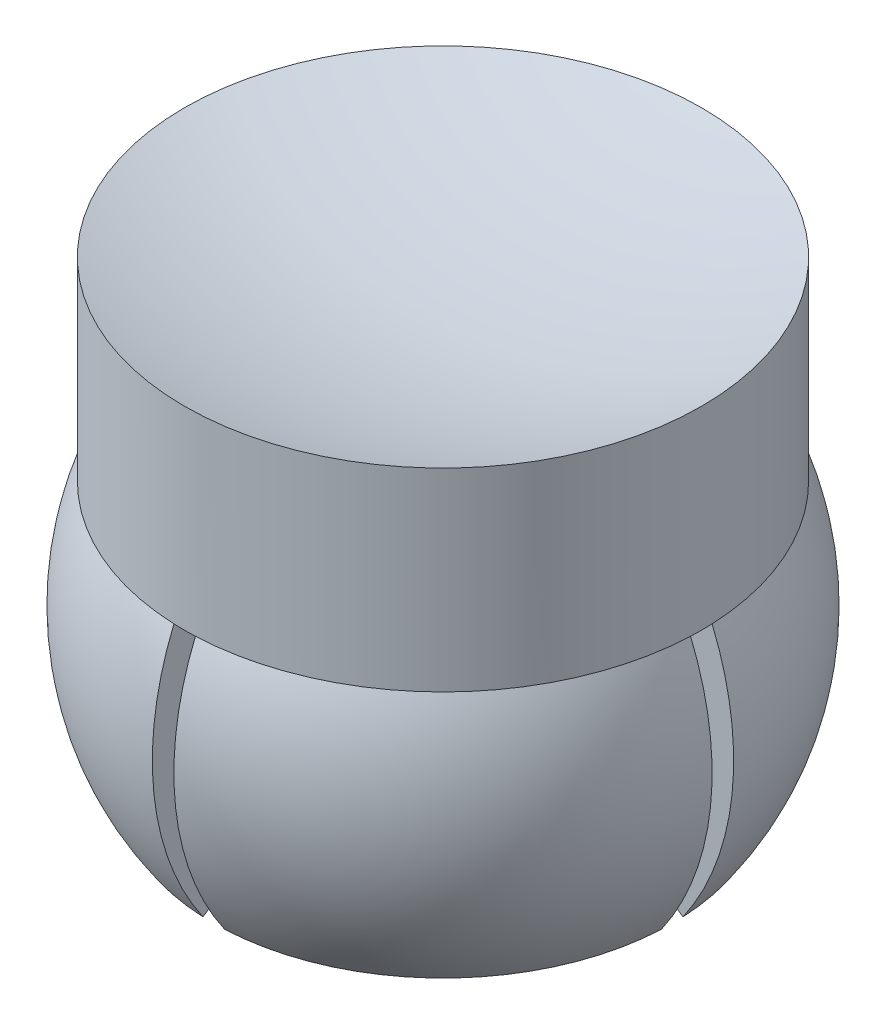
from build123d import *

# Parameters (mm, degrees)
SKETCH2_W          = 0.5
SKETCH2_H          = 6.228246836
CUT_EXTRUDE1_DEPTH = 10
CIRPATTERN1_COUNT  = 4


with BuildPart() as part:
    # Sketch1 → Revolve1 (revolve)
    with BuildSketch(Plane.XY):
        with BuildLine():
            Line((0, 6), (0, 5))
            ThreePointArc((0, 5), (4.435054166, 2.308743066), (4.095760221, -2.867882182))
            Line((4.095760221, -2.867882182), (5.324488288, -3.728246836))
            ThreePointArc((5.324488288, -3.728246836), (6.462102863, -0.700875589), (6, 2.5))
            Line((6, 2.5), (6, 7))
            ThreePointArc((6, 7), (3.041381265, 6.251712409), (0, 6))
        make_face()
    revolve(axis=Axis((0, 6, 0), (0, -1, 0)))

    # Sketch2 → Cut-Extrude1 (cut)
    with BuildSketch(Plane.XY):
        with Locations((0, -0.614123418)):
            Rectangle(SKETCH2_W, SKETCH2_H)
    cut_extrude1 = extrude(amount=-CUT_EXTRUDE1_DEPTH, mode=Mode.SUBTRACT)

    # CirPattern1: Cut-Extrude1 ×4 about axis
    cirpattern1_axis = Axis((0, -3.728246836, 0), (0, 1, 0))
    for i in range(1, CIRPATTERN1_COUNT):
        add(cut_extrude1.rotate(cirpattern1_axis, i * 360 / CIRPATTERN1_COUNT), mode=Mode.SUBTRACT)


solid = part.part
